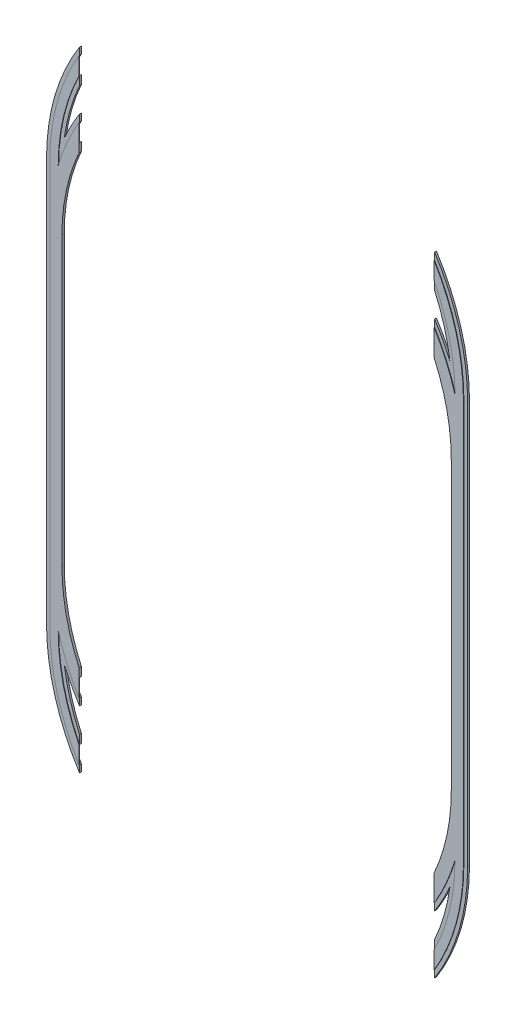
from build123d import *

# Parameters (mm, degrees)
BOSS_EXTRUDE1_DEPTH   = 20
BOSS_EXTRUDE1_2_DEPTH = 20
BOSS_EXTRUDE2_DEPTH   = 20
BOSS_EXTRUDE2_2_DEPTH = 20
BOSS_EXTRUDE3_DEPTH   = 5
SKETCH5_W             = 3800
SKETCH5_H             = 576.541900626
CUT_EXTRUDE1_DEPTH    = 9360.453457287


with BuildPart() as part:
    # Sketch1 → Boss-Extrude1 (new body)
    with BuildSketch(Plane.XY):
        with BuildLine():
            ThreePointArc((3025.904993677, 1500.993778109), (902.754993677, 3624.143778109), (-1220.395006323, 1500.993778109))
            Line((-1220.395006323, 1500.993778109), (-1220.395006323, -1564.006221891))
            ThreePointArc((-1220.395006323, -1564.006221891), (902.754993677, -3687.156221891), (3025.904993677, -1564.006221891))
            Line((3025.904993677, -1564.006221891), (3025.904993677, 1500.993778109))
        make_face()
        with BuildLine():
            Line((-1180.395006323, -1564.006221891), (-1180.395006323, 1500.993778109))
            ThreePointArc((-1180.395006323, 1500.993778109), (902.754993677, 3584.143778109), (2985.904993677, 1500.993778109))
            Line((2985.904993677, 1500.993778109), (2985.904993677, -1564.006221891))
            ThreePointArc((2985.904993677, -1564.006221891), (902.754993677, -3647.156221891), (-1180.395006323, -1564.006221891))
        make_face(mode=Mode.SUBTRACT)
    extrude(amount=BOSS_EXTRUDE1_DEPTH)

    # Sketch3 → Boss-Extrude3 (add)
    with BuildSketch(Plane.XY.offset(20)):
        with BuildLine():
            ThreePointArc((-1310.395006323, -2184.006221891), (902.754993677, -4397.156221891), (3115.904993677, -2184.006221891))
            Line((3115.904993677, -2184.006221891), (3115.904993677, 2120.993778109))
            ThreePointArc((3115.904993677, 2120.993778109), (902.754993677, 4334.143778109), (-1310.395006323, 2120.993778109))
            Line((-1310.395006323, 2120.993778109), (-1310.395006323, -2184.006221891))
        make_face()
        with BuildLine():
            ThreePointArc((3025.899721638, -2188.737673504), (902.754993677, -4307.156221891), (-1220.389734283, -2188.737673504))
            ThreePointArc((-1220.389734283, -2188.737673504), (902.754993677, -3777.156221891), (3025.899721638, -2188.737673504))
        make_face(mode=Mode.SUBTRACT)
        with BuildLine():
            ThreePointArc((-1180.395006323, 1500.993778109), (902.754993677, 3584.143778109), (2985.904993677, 1500.993778109))
            Line((2985.904993677, 1500.993778109), (2985.904993677, -1564.006221891))
            ThreePointArc((2985.904993677, -1564.006221891), (902.754993677, -3647.156221891), (-1180.395006323, -1564.006221891))
            Line((-1180.395006323, -1564.006221891), (-1180.395006323, 1500.993778109))
        make_face(mode=Mode.SUBTRACT)
        with BuildLine():
            ThreePointArc((-1220.389734283, 2125.725229722), (902.754993677, 4244.143778109), (3025.899721638, 2125.725229722))
            ThreePointArc((3025.899721638, 2125.725229722), (902.754993677, 3714.143778109), (-1220.389734283, 2125.725229722))
        make_face(mode=Mode.SUBTRACT)
    extrude(amount=BOSS_EXTRUDE3_DEPTH)


with BuildPart() as body_2:
    # Sketch1 → Boss-Extrude1 2 (new body)
    with BuildSketch(Plane.XY):
        with BuildLine():
            ThreePointArc((3155.904993677, 2120.993778109), (902.754993677, 4374.143778109), (-1350.395006323, 2120.993778109))
            Line((-1350.395006323, 2120.993778109), (-1350.395006323, -2184.006221891))
            ThreePointArc((-1350.395006323, -2184.006221891), (902.754993677, -4437.156221891), (3155.904993677, -2184.006221891))
            Line((3155.904993677, -2184.006221891), (3155.904993677, 2120.993778109))
        make_face()
        with BuildLine():
            Line((-1310.395006323, -2184.006221891), (-1310.395006323, 2120.993778109))
            ThreePointArc((-1310.395006323, 2120.993778109), (902.754993677, 4334.143778109), (3115.904993677, 2120.993778109))
            Line((3115.904993677, 2120.993778109), (3115.904993677, -2184.006221891))
            ThreePointArc((3115.904993677, -2184.006221891), (902.754993677, -4397.156221891), (-1310.395006323, -2184.006221891))
        make_face(mode=Mode.SUBTRACT)
    extrude(amount=BOSS_EXTRUDE1_2_DEPTH)


with BuildPart() as body_3:
    # Sketch2 → Boss-Extrude2 (new body)
    with BuildSketch(Plane.XY.offset(20)):
        with BuildLine():
            ThreePointArc((3025.899721638, 2125.725229722), (902.754993677, 4244.143778109), (-1220.389734283, 2125.725229722))
            ThreePointArc((-1220.389734283, 2125.725229722), (902.754993677, 3714.143778109), (3025.899721638, 2125.725229722))
        make_face()
        with BuildLine():
            ThreePointArc((-1160.877193096, 2405.486520044), (902.754993677, 4204.143778109), (2966.387180451, 2405.486520044))
            ThreePointArc((2966.387180451, 2405.486520044), (902.754993677, 3754.143778109), (-1160.877193096, 2405.486520044))
        make_face(mode=Mode.SUBTRACT)
    extrude(amount=-BOSS_EXTRUDE2_DEPTH)


with BuildPart() as body_4:
    # Sketch2 → Boss-Extrude2 2 (new body)
    with BuildSketch(Plane.XY.offset(20)):
        with BuildLine():
            ThreePointArc((-1220.389734283, -2188.737673504), (902.754993677, -4307.156221891), (3025.899721638, -2188.737673504))
            ThreePointArc((3025.899721638, -2188.737673504), (902.754993677, -3777.156221891), (-1220.389734283, -2188.737673504))
        make_face()
        with BuildLine():
            ThreePointArc((2966.387180451, -2468.498963827), (902.754993677, -4267.156221891), (-1160.877193096, -2468.498963827))
            ThreePointArc((-1160.877193096, -2468.498963827), (902.754993677, -3817.156221891), (2966.387180451, -2468.498963827))
        make_face(mode=Mode.SUBTRACT)
    extrude(amount=-BOSS_EXTRUDE2_2_DEPTH)


with BuildPart() as cut_extrude1_tool:
    # Sketch5 → Cut-Extrude1 (new, through all)
    with BuildSketch(Plane(origin=(0, 4374.143778109, 0), x_dir=(1, 0, 0), z_dir=(0, 1, 0))):
        with Locations((902.754993677, -10)):
            Rectangle(SKETCH5_W, SKETCH5_H)
    extrude(amount=-CUT_EXTRUDE1_DEPTH)


with BuildPart() as part_1:
    add(part.part)

    # Cut-Extrude1: cut by cut_extrude1_tool
    add(cut_extrude1_tool.part, mode=Mode.SUBTRACT)


with BuildPart() as body_2_1:
    add(body_2.part)

    # Cut-Extrude1: cut by cut_extrude1_tool
    add(cut_extrude1_tool.part, mode=Mode.SUBTRACT)


with BuildPart() as body_3_1:
    add(body_3.part)

    # Cut-Extrude1: cut by cut_extrude1_tool
    add(cut_extrude1_tool.part, mode=Mode.SUBTRACT)


with BuildPart() as body_4_1:
    add(body_4.part)

    # Cut-Extrude1: cut by cut_extrude1_tool
    add(cut_extrude1_tool.part, mode=Mode.SUBTRACT)


with BuildPart() as cut_extrude1_piece_1:
    # of the separate pieces the step leaves, piece 1, a body of its own (cut_extrude1_pieces)
    add(part_1.part.solids().sort_by_distance((-997.245006323, 2448.498882317, 0))[0])


with BuildPart() as cut_extrude1_piece_2:
    # of the separate pieces the step leaves, piece 2, a body of its own (cut_extrude1_pieces)
    add(part_1.part.solids().sort_by_distance((3025.904993677, 1500.993778109, 0))[0])


with BuildPart() as cut_extrude1_piece_1_of_body_2:
    # of the separate pieces the step leaves, piece 1, a body of its own (cut_extrude1_pieces_of_body_2)
    add(body_2_1.part.solids().sort_by_distance((2802.754993677, -3395.073900636, 0))[0])


with BuildPart() as cut_extrude1_piece_2_of_body_2:
    # of the separate pieces the step leaves, piece 2, a body of its own (cut_extrude1_pieces_of_body_2)
    add(body_2_1.part.solids().sort_by_distance((-1350.395006323, -2184.006221891, 0))[0])


with BuildPart() as cut_extrude1_piece_1_of_body_3:
    # of the separate pieces the step leaves, piece 1, a body of its own (cut_extrude1_pieces_of_body_3)
    add(body_3_1.part.solids().sort_by_distance((2802.754993677, 2635.909159316, 20))[0])


with BuildPart() as cut_extrude1_piece_2_of_body_3:
    # of the separate pieces the step leaves, piece 2, a body of its own (cut_extrude1_pieces_of_body_3)
    add(body_3_1.part.solids().sort_by_distance((-1220.389734283, 2125.725229722, 20))[0])


with BuildPart() as cut_extrude1_piece_1_of_body_4:
    # of the separate pieces the step leaves, piece 1, a body of its own (cut_extrude1_pieces_of_body_4)
    add(body_4_1.part.solids().sort_by_distance((-997.245006323, -2698.921603098, 20))[0])


with BuildPart() as cut_extrude1_piece_2_of_body_4:
    # of the separate pieces the step leaves, piece 2, a body of its own (cut_extrude1_pieces_of_body_4)
    add(body_4_1.part.solids().sort_by_distance((3025.899721638, -2188.737673504, 20))[0])


solid = Compound([cut_extrude1_piece_1.part, cut_extrude1_piece_2.part, cut_extrude1_piece_1_of_body_2.part, cut_extrude1_piece_2_of_body_2.part, cut_extrude1_piece_1_of_body_3.part, cut_extrude1_piece_2_of_body_3.part, cut_extrude1_piece_1_of_body_4.part, cut_extrude1_piece_2_of_body_4.part])
